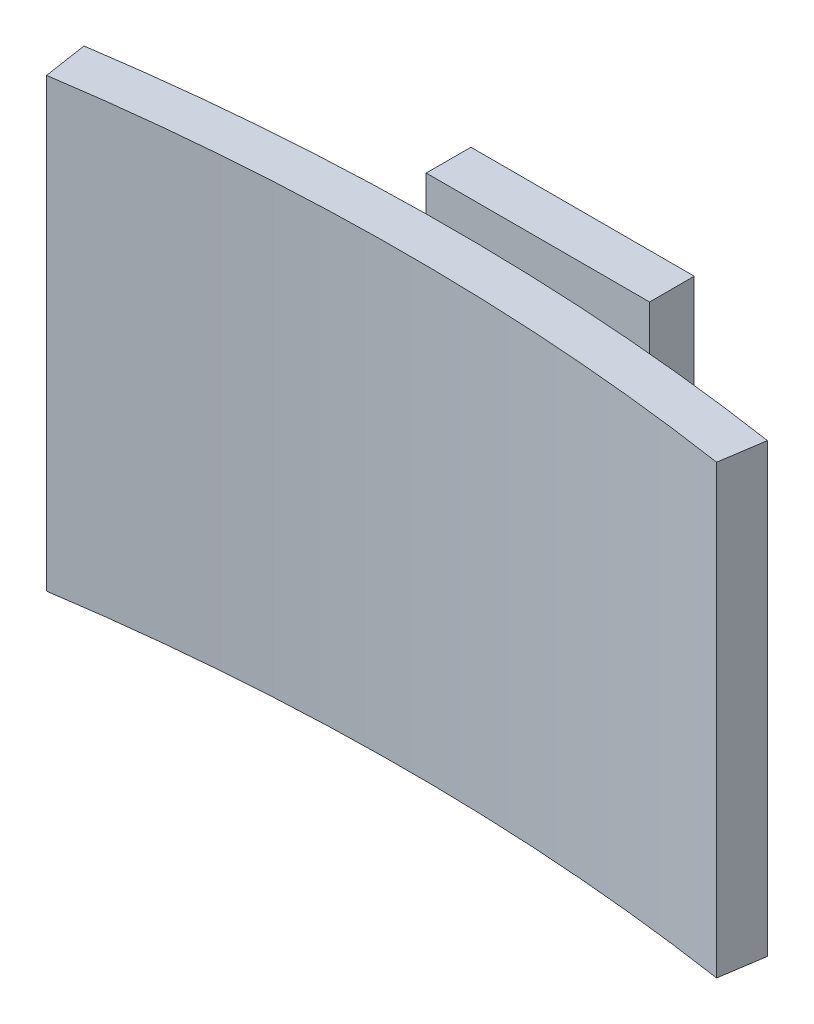
from build123d import *

# Parameters (mm, degrees)
BOSS_EXTRUDE1_DEPTH      = 20
BOSS_EXTRUDE2_REACH      = 36.375
BOSS_EXTRUDE2_END_RADIUS = 102
BOSS_EXTRUDE2_START      = -9
SKETCH3_W                = 10
SKETCH3_H                = 2.5
SKETCH4_W                = 10
SKETCH4_H                = 2
BOSS_EXTRUDE3_DEPTH      = 10
CHAMFER2_SIZE            = 3
CHAMFER2_SIZE2           = 1.732050808
CHAMFER1_SIZE            = 4
CHAMFER1_SIZE2           = 2.309401077
SKETCH6_W                = 10
SKETCH6_H                = 1
BOSS_EXTRUDE4_DEPTH      = 0.2
CHAMFER3_SIZE            = 0.5


with BuildPart() as part:
    # Sketch2 → Boss-Extrude1 (new body)
    with BuildSketch(Plane(origin=(0, 0, 0), x_dir=(1, 0, 0), z_dir=(0, 1, 0))):
        with BuildLine():
            Line((-15.3, 1.977371993), (-15, 0))
            ThreePointArc((-15, 0), (0, 1.131400334), (15, 0))
            Line((15, 0), (15.3, 1.977371993))
            ThreePointArc((15.3, 1.977371993), (0, 3.131400334), (-15.3, 1.977371993))
        make_face()
    extrude(amount=BOSS_EXTRUDE1_DEPTH)

    # Boss-Extrude2: up to this cylinder (the profile starts outside it)
    boss_extrude2_end = Plane(origin=(0, 6.463137, 98.868599666), z_dir=(0, -1, 0)) * Cylinder(BOSS_EXTRUDE2_END_RADIUS, 277.75, mode=Mode.PRIVATE)
    # Sketch3 → Boss-Extrude2 (add, up to the surface)
    with BuildSketch(Plane.XY.offset(BOSS_EXTRUDE2_START), mode=Mode.PRIVATE) as boss_extrude2_sk1:
        with Locations((0, 6.463137396)):
            Rectangle(SKETCH3_W, SKETCH3_H)
    boss_extrude2_tool1 = extrude(boss_extrude2_sk1.sketch, amount=BOSS_EXTRUDE2_REACH, mode=Mode.PRIVATE) - boss_extrude2_end
    add(boss_extrude2_tool1.solids().sort_by_distance((0, 6.463137, -9))[0])

    # Sketch4 → Boss-Extrude3 (add)
    with BuildSketch(Plane(origin=(0, 7.713137396, 0), x_dir=(1, 0, 0), z_dir=(0, 1, 0))):
        with Locations((0, 8)):
            Rectangle(SKETCH4_W, SKETCH4_H)
    extrude(amount=BOSS_EXTRUDE3_DEPTH)

    # Chamfer2
    chamfer2_edges = [part.edges().sort_by_distance(p)[0] for p in [
        (0, 7.713137396, -7),
    ]]
    chamfer2_side = [part.faces().sort_by_distance(p)[0] for p in [
        (0, 12.713137396, -7),
    ]]
    chamfer(chamfer2_edges, length=CHAMFER2_SIZE, length2=CHAMFER2_SIZE2, reference=chamfer2_side[0])

    # Chamfer1
    chamfer1_edges = [part.edges().sort_by_distance(p)[0] for p in [
        (0, 5.213137396, -9),
    ]]
    chamfer1_side = [part.faces().sort_by_distance(p)[0] for p in [
        (0, 11.463137396, -9),
    ]]
    chamfer(chamfer1_edges, length=CHAMFER1_SIZE, length2=CHAMFER1_SIZE2, reference=chamfer1_side[0])

    # Sketch6 → Boss-Extrude4 (add)
    with BuildSketch(Plane.XY.offset(-7)):
        with Locations((0, 13.213137396)):
            Rectangle(SKETCH6_W, SKETCH6_H)
    extrude(amount=BOSS_EXTRUDE4_DEPTH)

    # Chamfer3
    # the kernel refuses this chamfer: 0.5 mm, written as the material it takes off along each edge
    with BuildSketch(Plane(origin=(-6.285841494, 13.713137396, -6.8), x_dir=(0, 0.027495876610585647, -0.9996219169112968), z_dir=(1, 0, 0))) as chamfer3_piece_1_section:
        Polygon((CHAMFER3_SIZE * 0.999621916911, -CHAMFER3_SIZE * 0.0274958766106), (-CHAMFER3_SIZE * 0.0274958766106, -CHAMFER3_SIZE * 0.999621916911), (0, 0), align=None)
    chamfer3_piece_1 = extrude(amount=12.571682988, mode=Mode.PRIVATE)
    chamfer3_piece_1 = split(chamfer3_piece_1, bisect_by=Plane(origin=(0, 13.506192151, -7), z_dir=(0, 0, 1)), keep=Keep.TOP, mode=Mode.PRIVATE)
    add(chamfer3_piece_1, mode=Mode.SUBTRACT)


solid = part.part
